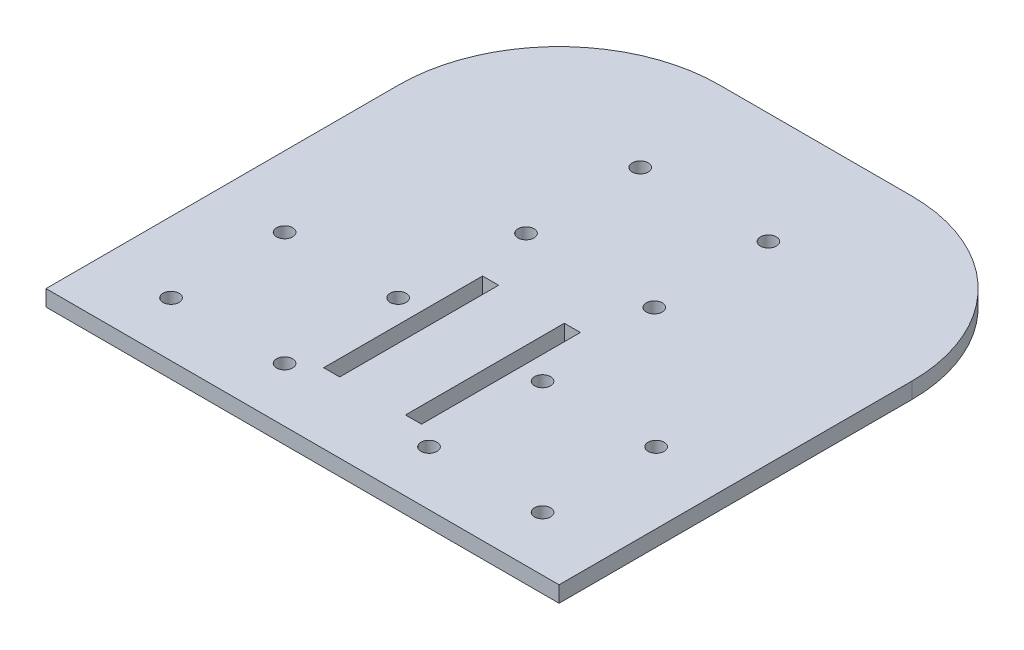
from build123d import *

# Parameters (mm, degrees)
SKETCH1_W           = 203.2
SKETCH1_H           = 203.2
BOSS_EXTRUDE1_DEPTH = 6.35
CUT_EXTRUDE1_DEPTH  = 144.824345992
SKETCH10_R          = 3.175
SKETCH10_W          = 6.35
SKETCH10_H          = 62.924217451
CUT_EXTRUDE4_DEPTH  = 144.824345992


with BuildPart() as part:
    # Sketch1 → Boss-Extrude1 (new body)
    with BuildSketch(Plane(origin=(0, 0, 0), x_dir=(1, 0, 0), z_dir=(0, 1, 0))):
        Rectangle(SKETCH1_W, SKETCH1_H)
    extrude(amount=BOSS_EXTRUDE1_DEPTH)

    # Sketch2 → Cut-Extrude1 (cut, through all)
    with BuildSketch(Plane(origin=(0, 6.35, 0), x_dir=(1, 0, 0), z_dir=(0, 1, 0))):
        with BuildLine():
            Line((101.6, 38.1), (101.6, 101.6))
            Line((101.6, 101.6), (38.1, 101.6))
            ThreePointArc((38.1, 101.6), (83.001280605, 83.001280605), (101.6, 38.1))
        make_face()
        with BuildLine():
            Line((-38.1, 101.6), (-101.6, 101.6))
            Line((-101.6, 101.6), (-101.6, 38.1))
            ThreePointArc((-101.6, 38.1), (-83.001280605, 83.001280605), (-38.1, 101.6))
        make_face()
    extrude(amount=-CUT_EXTRUDE1_DEPTH, mode=Mode.SUBTRACT)

    # Sketch10 → Cut-Extrude4 (cut, through all)
    with BuildSketch(Plane.XZ):
        with Locations((-73.66, 80.015705209)):
            Circle(SKETCH10_R)
        with Locations((-28.696294791, 80.015705209)):
            Circle(SKETCH10_R)
        with Locations((-73.66, 35.052)):
            Circle(SKETCH10_R)
        with Locations((-28.696294791, 35.052)):
            Circle(SKETCH10_R)
        with Locations((28.515782549, 80.015705209)):
            Circle(SKETCH10_R)
        with Locations((73.479487758, 80.015705209)):
            Circle(SKETCH10_R)
        with Locations((73.479487758, 35.052)):
            Circle(SKETCH10_R)
        with Locations((28.515782549, 35.052)):
            Circle(SKETCH10_R)
        with Locations((25.309743879, -12.40083867)):
            Circle(SKETCH10_R)
        with Locations((-25.490256121, -12.40083867)):
            Circle(SKETCH10_R)
        with Locations((-25.490256121, -57.61283867)):
            Circle(SKETCH10_R)
        with Locations((25.309743879, -57.61283867)):
            Circle(SKETCH10_R)
        with Locations((-16.28703867, 42.293852605)):
            Rectangle(SKETCH10_W, SKETCH10_H)
        with Locations((16.106526428, 42.293852605)):
            Rectangle(SKETCH10_W, SKETCH10_H)
    extrude(amount=-CUT_EXTRUDE4_DEPTH, mode=Mode.SUBTRACT)


solid = part.part
